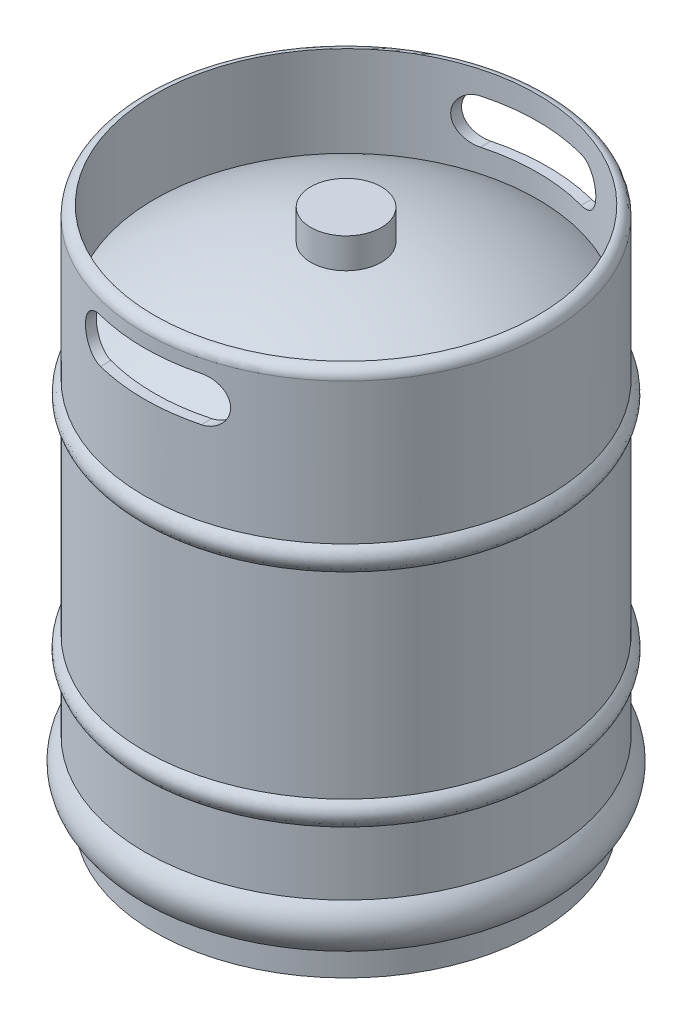
from build123d import *

# Parameters (mm, degrees)
SKETCH2_R           = 190
CUT_EXTRUDE1_DEPTH  = 90
FILLET1_R           = 10
CUT_EXTRUDE2_DEPTH  = 250
DOME1_FACE_RADIUS   = 190
DOME1_HEIGHT        = 60
SKETCH5_R           = 190
BOSS_EXTRUDE1_DEPTH = 30
BOSS_EXTRUDE2_START = 468.143405
SKETCH6_R           = 35
BOSS_EXTRUDE2_DEPTH = 30
SKETCH7_R           = 180
CUT_EXTRUDE3_DEPTH  = 50
DOME2_FACE_RADIUS   = 180
DOME2_HEIGHT        = 50


with BuildPart() as part:
    # Sketch1 → Revolve1 (revolve)
    with BuildSketch(Plane.XY, mode=Mode.PRIVATE) as revolve1_sk:
        with BuildLine():
            Line((0, 500), (0, 0))
            Line((0, 0), (200, 0))
            add(Edge.make_bspline(
                [(200, 44), (219.766886066, 22.123059656), (200, 0)],
                knots=[0, 0, 0, 1, 1, 1], degree=2))
            Line((200, 44), (200, 106.773063114))
            add(Edge.make_bspline(
                [(200, 130.773063114), (212.717893657, 119.829456351), (200, 106.773063114)],
                knots=[0, 0, 0, 1, 1, 1], degree=2))
            Line((200, 130.773063114), (200, 326))
            add(Edge.make_bspline(
                [(200, 350), (212.44043914, 338.320876657), (200, 326)],
                knots=[0, 0, 0, 1, 1, 1], degree=2))
            Line((200, 350), (200, 500))
            Line((200, 500), (0, 500))
        make_face()
    revolve(revolve1_sk.sketch.rotate(Axis((0, 500, 0), (0, -1, 0)), 90), axis=Axis((0, 500, 0), (0, -1, 0)))

    # Sketch2 → Cut-Extrude1 (cut)
    with BuildSketch(Plane(origin=(0, 500, 0), x_dir=(1, 0, 0), z_dir=(0, 1, 0))):
        with Locations(Location((0, 0, 0), (0, 0, 270))):
            Circle(SKETCH2_R)
    extrude(amount=-CUT_EXTRUDE1_DEPTH, mode=Mode.SUBTRACT)

    # Fillet1
    fillet1_edges = [part.edges().sort_by_distance(p)[0] for p in [
        (0, 500, -200),
    ]]
    fillet(fillet1_edges, radius=FILLET1_R - 0.0001)  # a hair under: the kernel refuses the full size

    # Sketch3 → Cut-Extrude2 (cut, symmetric)
    with BuildSketch(Plane.XY):
        with BuildLine():
            Line((-50, 477), (50, 477))
            ThreePointArc((50, 477), (72, 455), (50, 433))
            Line((50, 433), (-50, 433))
            ThreePointArc((-50, 433), (-72, 455), (-50, 477))
        make_face()
    extrude(amount=CUT_EXTRUDE2_DEPTH, both=True, mode=Mode.SUBTRACT)

    # Dome1: a dome of height H over a round flat face of radius A is a cap of a sphere of radius (A * A + H * H) / (2 * H)
    dome1_r = (DOME1_FACE_RADIUS * DOME1_FACE_RADIUS + DOME1_HEIGHT * DOME1_HEIGHT) / (2 * DOME1_HEIGHT)
    dome1_base = Plane((0, 410, 0), z_dir=(0, 1, 0))
    with Locations(dome1_base.offset(DOME1_HEIGHT - dome1_r)):
        dome1_ball = Sphere(dome1_r, mode=Mode.PRIVATE)
    add(split(dome1_ball, bisect_by=dome1_base, keep=Keep.TOP, mode=Mode.PRIVATE))


with BuildPart() as body_2:
    # Sketch5 → Boss-Extrude1 (new body)
    with BuildSketch(Plane.XZ):
        with Locations(Location((0, 0, 0), (0, 0, 270))):
            Circle(SKETCH5_R)
    extrude(amount=BOSS_EXTRUDE1_DEPTH)


with BuildPart() as body_3:
    # Sketch6 → Boss-Extrude2 (new body)
    with BuildSketch(Plane(origin=(0, 0, 0), x_dir=(1, 0, 0), z_dir=(0, 1, 0)).offset(BOSS_EXTRUDE2_START)):
        with Locations(Location((0, 0, 0), (0, 0, 90))):
            Circle(SKETCH6_R)
    extrude(amount=BOSS_EXTRUDE2_DEPTH)


with BuildPart() as cut_extrude3_tool:
    # Sketch7 → Cut-Extrude3 (new body)
    with BuildSketch(Plane.XZ.offset(30)):
        with Locations(Location((0, 0, 0), (0, 0, 270))):
            Circle(SKETCH7_R)
    extrude(amount=-CUT_EXTRUDE3_DEPTH)


with BuildPart() as part_1:
    add(part.part)

    # Cut-Extrude3: cut by cut_extrude3_tool
    add(cut_extrude3_tool.part, mode=Mode.SUBTRACT)

    # Dome2: a dome of height H over a round flat face of radius A is a cap of a sphere of radius (A * A + H * H) / (2 * H)
    dome2_r = (DOME2_FACE_RADIUS * DOME2_FACE_RADIUS + DOME2_HEIGHT * DOME2_HEIGHT) / (2 * DOME2_HEIGHT)
    dome2_base = Plane((0, 20, 0), z_dir=(0, -1, 0))
    with Locations(dome2_base.offset(DOME2_HEIGHT - dome2_r)):
        dome2_ball = Sphere(dome2_r, mode=Mode.PRIVATE)
    add(split(dome2_ball, bisect_by=dome2_base, keep=Keep.TOP, mode=Mode.PRIVATE))


with BuildPart() as body_2_1:
    add(body_2.part)

    # Cut-Extrude3: cut by cut_extrude3_tool
    add(cut_extrude3_tool.part, mode=Mode.SUBTRACT)


solid = Compound([body_3.part, part_1.part, body_2_1.part])
